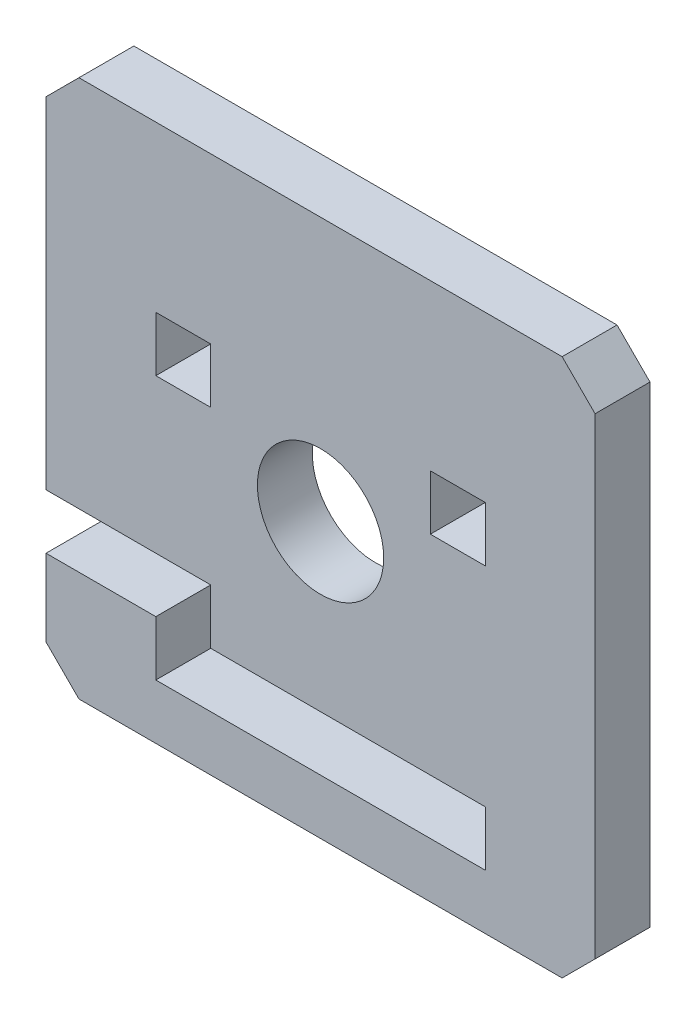
from build123d import *

# Parameters (mm, degrees)
SKETCH1_R           = 5.75
SKETCH1_W           = 5
SKETCH1_H           = 5
BOSS_EXTRUDE1_DEPTH = 5


with BuildPart() as part:
    # Sketch1 → Boss-Extrude1 (new body)
    with BuildSketch(Plane.XY):
        Polygon((-25, 21), (-22, 24), (22, 24), (25, 21), (25, -22), (22, -25), (-22, -25), (-25, -22), (-25, -15), (-15, -15), (-15, -20), (15, -20), (15, -15), (-10, -15), (-10, -10), (-25, -10), align=None)
        Circle(SKETCH1_R, mode=Mode.SUBTRACT)
        with Locations((12.5, 6.5)):
            Rectangle(SKETCH1_W, SKETCH1_H, mode=Mode.SUBTRACT)
        with Locations((-12.5, 6.5)):
            Rectangle(SKETCH1_W, SKETCH1_H, mode=Mode.SUBTRACT)
    extrude(amount=BOSS_EXTRUDE1_DEPTH)


solid = part.part
